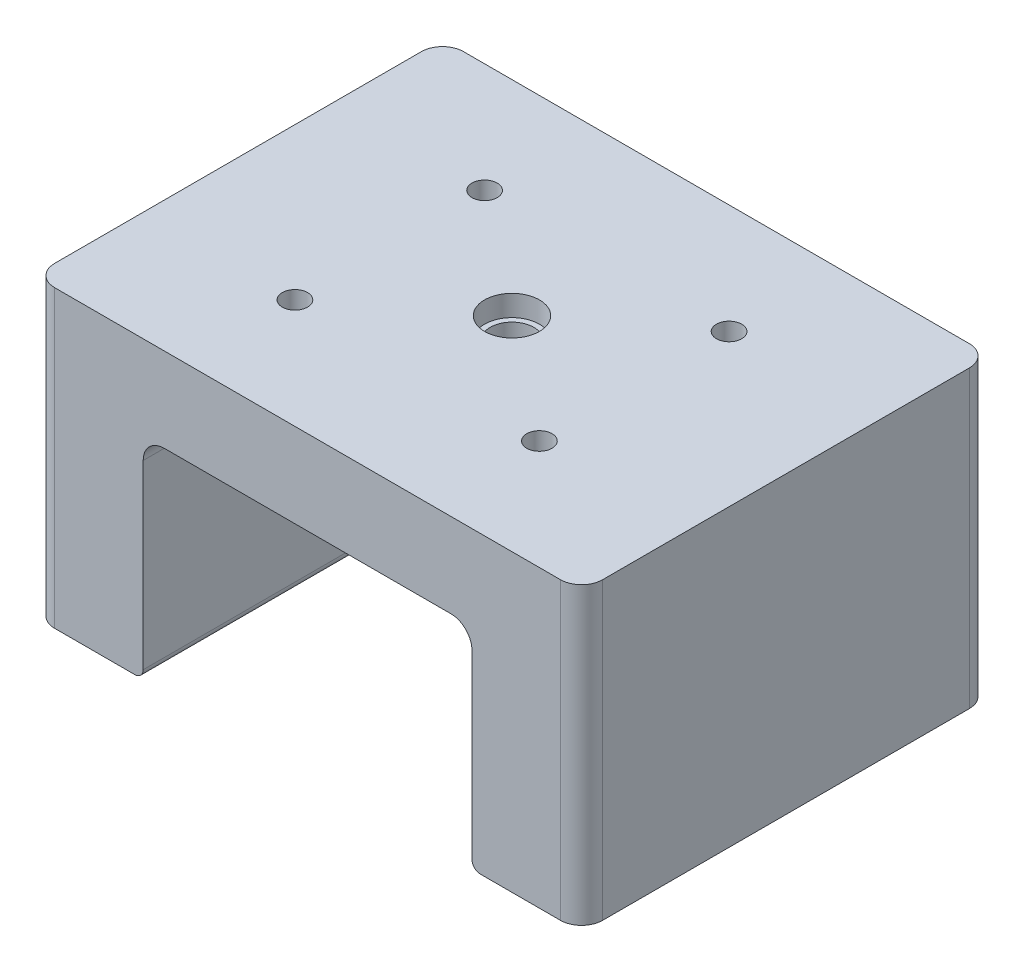
from build123d import *

# Parameters (mm, degrees)
SKETCH1_W                = 130
SKETCH1_H                = 97
BOSS_EXTRUDE1_DEPTH      = 70
SKETCH2_W                = 78
SKETCH2_H                = 50
CUT_EXTRUDE1_DEPTH       = 137.1396342
FILLET3_R                = 5
SKETCH3_R                = 5.2
CUT_EXTRUDE2_DEPTH       = 108.131928014
SKETCH4_R                = 6.5
CUT_EXTRUDE3_DEPTH       = 5
FILLET2_R                = 5
FILLET4_R                = 2
F_5_0_5_DIAMETER_HOLE1_D = 6


with BuildPart() as part:
    # Sketch1 → Boss-Extrude1 (new body)
    with BuildSketch(Plane(origin=(0, 0, 0), x_dir=(1, 0, 0), z_dir=(0, 1, 0))):
        Rectangle(SKETCH1_W, SKETCH1_H)
    extrude(amount=BOSS_EXTRUDE1_DEPTH)

    # Sketch2 → Cut-Extrude1 (cut, through all)
    with BuildSketch(Plane.XY.offset(48.5)):
        with Locations((0, 25)):
            Rectangle(SKETCH2_W, SKETCH2_H)
    extrude(amount=-CUT_EXTRUDE1_DEPTH, mode=Mode.SUBTRACT)

    # Fillet3
    fillet3_edges = [part.edges().sort_by_distance(p)[0] for p in [
        (39, 50, 0),
        (-39, 50, 0),
    ]]
    fillet(fillet3_edges, radius=FILLET3_R)

    # Sketch3 → Cut-Extrude2 (cut, through all)
    with BuildSketch(Plane(origin=(0, 70, 0), x_dir=(1, 0, 0), z_dir=(0, 1, 0))):
        Circle(SKETCH3_R)
    extrude(amount=-CUT_EXTRUDE2_DEPTH, mode=Mode.SUBTRACT)

    # Sketch4 → Cut-Extrude3 (cut)
    with BuildSketch(Plane(origin=(0, 70, 0), x_dir=(1, 0, 0), z_dir=(0, 1, 0))):
        Circle(SKETCH4_R)
    extrude(amount=-CUT_EXTRUDE3_DEPTH, mode=Mode.SUBTRACT)

    # Fillet2
    fillet2_edges = [part.edges().sort_by_distance(p)[0] for p in [
        (-65, 35, -48.5),
        (-65, 35, 48.5),
        (65, 35, -48.5),
        (65, 35, 48.5),
    ]]
    fillet(fillet2_edges, radius=FILLET2_R)

    # Fillet4
    fillet4_edges = [part.edges().sort_by_distance(p)[0] for p in [
        (39, 0, 0),
        (-39, 0, 0),
    ]]
    fillet(fillet4_edges, radius=FILLET4_R)

    # Ø5.0 (5) Diameter Hole1 (through all)
    with Locations(Plane(origin=(0, 70, 0), x_dir=(1, 0, 0), z_dir=(0, 1, 0))):
        with Locations((-29, 22.5), (29, 22.5), (29, -22.5), (-29, -22.5)):
            Hole(F_5_0_5_DIAMETER_HOLE1_D / 2)


solid = part.part
